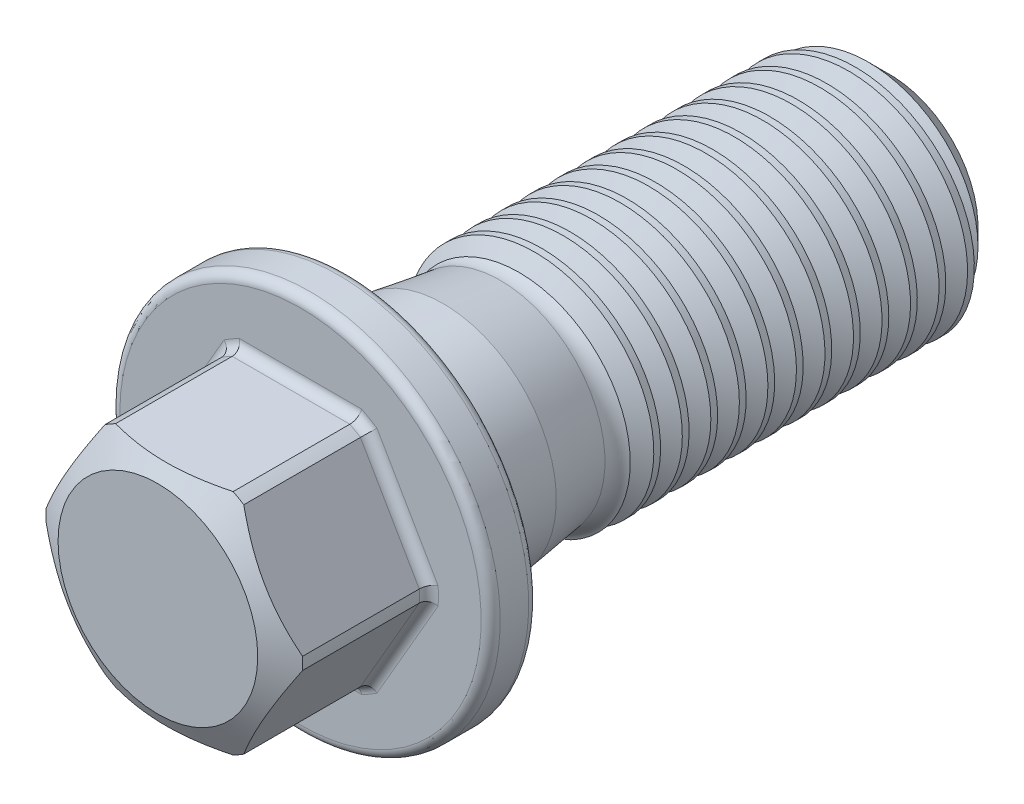
from build123d import *

# Parameters (mm, degrees)
CUT_EXTRUDE1_DEPTH = 15
CUT_SWEEP3_PITCH   = 3
FILLET1_R          = 1


with BuildPart() as part:
    # Sketch1 → Revolve1 (revolve)
    with BuildSketch(Plane(origin=(0, 0, 0), x_dir=(0, 0, -1), z_dir=(1, 0, 0)), mode=Mode.PRIVATE) as revolve1_sk:
        with BuildLine():
            Line((0, 0), (-77, 0))
            Line((-77, 0), (-77, 10.5))
            Line((-77, 10.5), (-75.267949192, 13.5))
            Line((-75.267949192, 13.5), (-62, 13.5))
            Line((-62, 13.5), (-62, 19))
            ThreePointArc((-62, 19), (-61.707106781, 19.707106781), (-61, 20))
            Line((-61, 20), (-58, 20))
            ThreePointArc((-58, 20), (-57.292893219, 19.707106781), (-57, 19))
            Line((-57, 19), (-57, 12.9))
            ThreePointArc((-57, 12.9), (-56.707106781, 12.192893219), (-56, 11.9))
            Line((-56, 11.9), (-47, 11.9))
            Line((-47, 11.9), (-41, 11.021117296))
            ThreePointArc((-41, 11.021117296), (-39.715544766, 11.264835599), (-38.856082748, 12.25))
            Line((-38.856082748, 12.25), (-3, 12.25))
            Line((-3, 12.25), (0, 9.25))
            Line((0, 9.25), (0, 0))
        make_face()
    revolve(revolve1_sk.sketch.rotate(Axis((0, 0, 0), (0, 0, 1)), 90), axis=Axis((0, 0, 0), (0, 0, 1)))

    # Sketch2 → Cut-Extrude1 (cut)
    with BuildSketch(Plane.XY.offset(77)):
        Polygon((-8.371578903, 14.5), (-16.743157806, 0), (-8.371578903, -14.5), (8.371578903, -14.5), (16.743157806, 0), (8.371578903, 14.5), align=None)
        Polygon((13.856406461, 0), (6.92820323, 12), (-6.92820323, 12), (-13.856406461, 0), (-6.92820323, -12), (6.92820323, -12), align=None, mode=Mode.SUBTRACT)
    extrude(amount=-CUT_EXTRUDE1_DEPTH, mode=Mode.SUBTRACT)

    # Cut-Sweep3: the profile of Sketch4 screwed along a right-hand helix of 13.5 turns, 10 arcs to a turn; built about Z, then put on its axis
    cut_sweep3_z = Axis((0, 0, 0), (0, 0, 1))
    cut_sweep3_corners = [(10.268526543, 0, 0), (12.865736729, 0, -1.4995), (12.865736729, 0, 1.4995)]
    with BuildLine(mode=Mode.PRIVATE) as cut_sweep3_profile:
        Line(cut_sweep3_corners[0], cut_sweep3_corners[1])
        Line(cut_sweep3_corners[1], cut_sweep3_corners[2])
        Line(cut_sweep3_corners[2], cut_sweep3_corners[0])
    cut_sweep3_cap = Face(cut_sweep3_profile.wire())
    cut_sweep3_turn_angles = [0, 18, 36, 54, 72, 90, 108, 126, 144, 162, 180, 198, 216, 234, 252, 270, 288, 306, 324, 342, 360]
    cut_sweep3_turn_weights = [1, 0.9510565162951535, 1, 0.9510565162951535, 1, 0.9510565162951535, 1, 0.9510565162951535, 1, 0.9510565162951535, 1, 0.9510565162951535, 1, 0.9510565162951535, 1, 0.9510565162951535, 1, 0.9510565162951535, 1, 0.9510565162951535, 1]
    cut_sweep3_turn_rails = [Edge.make_bspline([Vector(p[0], p[1], 0).rotate(cut_sweep3_z, cut_sweep3_turn_angles[k]) / cut_sweep3_turn_weights[k] + Vector(0, 0, p[2] + CUT_SWEEP3_PITCH * cut_sweep3_turn_angles[k] / 360) for k in range(21)], [0, 0, 0, 1, 1, 2, 2, 3, 3, 4, 4, 5, 5, 6, 6, 7, 7, 8, 8, 9, 9, 10, 10, 10], 2, cut_sweep3_turn_weights) for p in cut_sweep3_corners]
    cut_sweep3_turn_sides = [Face.make_surface_from_curves(cut_sweep3_turn_rails[p[0]], cut_sweep3_turn_rails[p[1]]) for p in [(0, 1), (1, 2), (2, 0)]]
    cut_sweep3_last_angles = [4680, 4698, 4716, 4734, 4752, 4770, 4788, 4806, 4824, 4842, 4860]
    cut_sweep3_last_weights = [1, 0.9510565162951535, 1, 0.9510565162951535, 1, 0.9510565162951535, 1, 0.9510565162951535, 1, 0.9510565162951192, 1]
    cut_sweep3_last_rails = [Edge.make_bspline([Vector(p[0], p[1], 0).rotate(cut_sweep3_z, cut_sweep3_last_angles[k]) / cut_sweep3_last_weights[k] + Vector(0, 0, p[2] + CUT_SWEEP3_PITCH * cut_sweep3_last_angles[k] / 360) for k in range(11)], [0, 0, 0, 1, 1, 2, 2, 3, 3, 4, 4, 5, 5, 5], 2, cut_sweep3_last_weights) for p in cut_sweep3_corners]
    cut_sweep3_last_sides = [Face.make_surface_from_curves(cut_sweep3_last_rails[p[0]], cut_sweep3_last_rails[p[1]]) for p in [(0, 1), (1, 2), (2, 0)]]
    cut_sweep3 = Plane(origin=(0, 0, 0), x_dir=(0, 1, 0), z_dir=(0, 0, 1)) * Solid(Shell([*[p.moved(Location((0, 0, CUT_SWEEP3_PITCH * i))) for i in range(13) for p in cut_sweep3_turn_sides], *cut_sweep3_last_sides, cut_sweep3_cap, cut_sweep3_cap.rotate(cut_sweep3_z, 4860).moved(Location((0, 0, CUT_SWEEP3_PITCH * 4860 / 360)))]))
    add(cut_sweep3, mode=Mode.SUBTRACT)

    # Fillet1
    fillet1_edges = [part.edges().sort_by_distance(p)[0] for p in [
        (-6.75, 11.691342951, 62),
        (6.75, 11.691342951, 62),
        (13.5, 0, 62),
        (6.75, -11.691342951, 62),
        (-6.75, -11.691342951, 62),
        (-13.5, 0, 62),
        (10.392304845, 6, 62),
        (0, 12, 62),
        (-10.392304845, 6, 62),
        (-10.392304845, -6, 62),
        (0, -12, 62),
        (10.392304845, -6, 62),
    ]]
    fillet(fillet1_edges, radius=FILLET1_R)


solid = part.part
